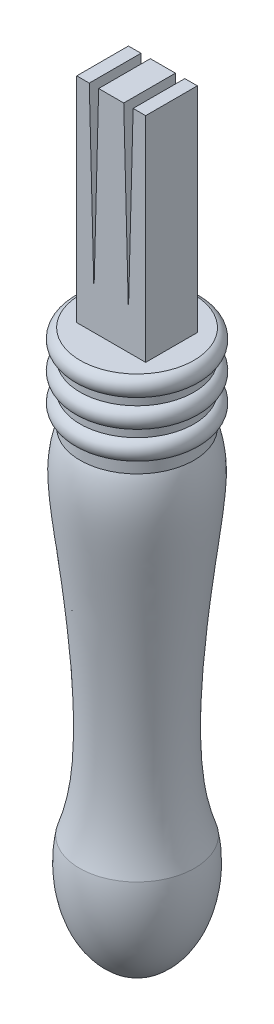
from build123d import *

# Parameters (mm, degrees)
SKETCH1_W                = 47.625
SKETCH1_H                = 47.625
BOSS_EXTRUDE1_DEPTH      = 279.4
SKETCH2_OUTSIDE_W        = 107.105
SKETCH2_OUTSIDE_H        = 107.105
SKETCH2_OUTSIDE_W_2      = 25.4
SKETCH2_OUTSIDE_H_2      = 19.05
CUT_EXTRUDE1_DEPTH       = 78.74
CUT_REVOLVE1_2_OUTLINE_W = 47.625
CUT_REVOLVE1_2_OUTLINE_H = 47.625
CUT_REVOLVE1_2_OUTLINE_R = 23.661811137
CUT_REVOLVE1_2_DEPTH     = 200.66
CUT_EXTRUDE2_DEPTH       = 78.74


with BuildPart() as part:
    # Sketch1 → Boss-Extrude1 (new body)
    with BuildSketch(Plane(origin=(0, 0, 0), x_dir=(1, 0, 0), z_dir=(0, 1, 0))):
        Rectangle(SKETCH1_W, SKETCH1_H)
    extrude(amount=BOSS_EXTRUDE1_DEPTH)

    # Sketch2 outside → Cut-Extrude1 (cut)
    with BuildSketch(Plane(origin=(0, 279.4, 0), x_dir=(1, 0, 0), z_dir=(0, 1, 0))):
        with Locations((0.0005, 0.0005)):
            Rectangle(SKETCH2_OUTSIDE_W, SKETCH2_OUTSIDE_H)
        Rectangle(SKETCH2_OUTSIDE_W_2, SKETCH2_OUTSIDE_H_2, mode=Mode.SUBTRACT)
    extrude(amount=-CUT_EXTRUDE1_DEPTH, mode=Mode.SUBTRACT)

    # Cut-Revolve1: read off the stored shape, not the designer's step
    # Cut-Revolve1 outline → Cut-Revolve1 (revolve, cut)
    with BuildSketch(Plane.XY):
        with BuildLine():
            add(Edge.make_bspline(
                [(21.226413076, 38.731784647), (23.834738993, 24.62140881), (19.896211677, 8.079594082), (9.768570007, 0)],
                knots=[0, 0, 0, 0, 1, 1, 1, 1], degree=3))
            Line((9.768570007, 0), (23.661811137, -1e-07))
            Line((23.661811137, -1e-07), (23.661811137, 176.696017869))
            ThreePointArc((23.661811137, 176.696017869), (22.914036435, 174.42910891), (20.964238315, 173.052035737))
            Line((20.964238315, 173.052035737), (20.964238315, 168.762129589))
            add(Edge.make_bspline(
                [(20.964238315, 168.762129589), (23.752022666, 162.022226447), (24.441330942, 151.529422692), (23.866907379, 145.861776868), (20.241372554, 132.614344063), (13.222438272, 79.405044367), (14.529209669, 57.843316323), (21.226413076, 38.731784647)],
                knots=[0, 0, 0, 0, 0, 0, 0, 0, 1, 1, 1, 1, 1, 1, 1, 1], degree=7))
        make_face()
        with BuildLine():
            ThreePointArc((20.964238315, 180.34), (22.914036435, 178.962926827), (23.661811137, 176.696017869))
            Line((23.661811137, 176.696017869), (23.661811137, 186.856017869))
            ThreePointArc((23.661811137, 186.856017869), (22.914036435, 184.58910891), (20.964238315, 183.212035737))
            Line((20.964238315, 183.212035737), (20.964238315, 180.34))
        make_face()
        with BuildLine():
            Line((23.661811137, 200.66), (20.964238315, 200.66))
            ThreePointArc((20.964238315, 200.66), (22.914036435, 199.282926827), (23.661811137, 197.016017869))
            Line((23.661811137, 197.016017869), (23.661811137, 200.66))
        make_face()
        with BuildLine():
            ThreePointArc((20.964238315, 190.5), (22.914036435, 189.122926827), (23.661811137, 186.856017869))
            Line((23.661811137, 186.856017869), (23.661811137, 197.016017869))
            ThreePointArc((23.661811137, 197.016017869), (22.914036435, 194.74910891), (20.964238315, 193.372035737))
            Line((20.964238315, 193.372035737), (20.964238315, 190.5))
        make_face()
    revolve(axis=Axis((0, 0, 0), (0, 1, 0)), mode=Mode.SUBTRACT)

    # Cut-Revolve1 2 outline → Cut-Revolve1 2 (cut)
    with BuildSketch(Plane(origin=(0, 0, 0), x_dir=(1, 0, 0), z_dir=(0, 1, 0))):
        Rectangle(CUT_REVOLVE1_2_OUTLINE_W, CUT_REVOLVE1_2_OUTLINE_H)
        Circle(CUT_REVOLVE1_2_OUTLINE_R, mode=Mode.SUBTRACT)
    extrude(amount=CUT_REVOLVE1_2_DEPTH, mode=Mode.SUBTRACT)

    # Sketch4 → Cut-Extrude2 (cut)
    with BuildSketch(Plane(origin=(0, 0, -9.525), x_dir=(-1, 0, 0), z_dir=(0, 0, -1))):
        Polygon((-8.07931826, 279.4), (-4.62068174, 279.4), (-6.35, 213.36), align=None)
        Polygon((8.07931826, 279.4), (4.62068174, 279.4), (6.35, 213.36), align=None)
    extrude(amount=-CUT_EXTRUDE2_DEPTH, mode=Mode.SUBTRACT)


solid = part.part
